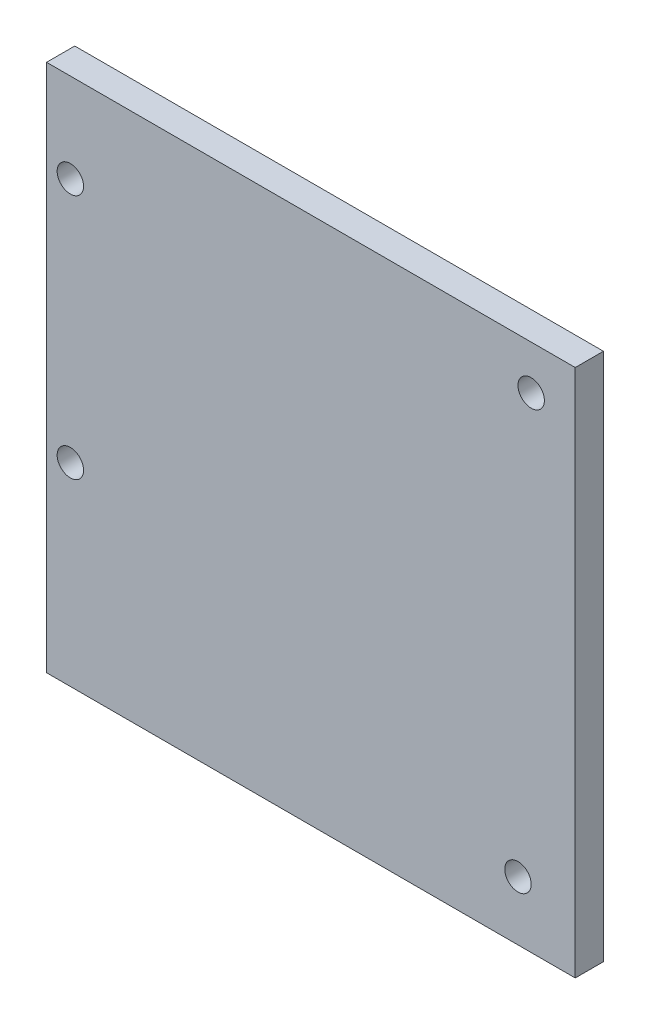
from build123d import *

# Parameters (mm, degrees)
SKETCH2_W           = 60
SKETCH2_H           = 60
BOSS_EXTRUDE2_DEPTH = 3.2
SKETCH3_R           = 1.5
CUT_EXTRUDE1_DEPTH  = 3.2


with BuildPart() as part:
    # Sketch2 → Boss-Extrude2 (new body)
    with BuildSketch(Plane.XY):
        with Locations((-2.549375328, 21.639166253)):
            Rectangle(SKETCH2_W, SKETCH2_H)
    extrude(amount=BOSS_EXTRUDE2_DEPTH)

    # Sketch3 → Cut-Extrude1 (cut)
    with BuildSketch(Plane.XY.offset(3.2)):
        with Locations((20.950624672, -1.660833747)):
            Circle(SKETCH3_R)
        with Locations((22.450624672, 46.639166253)):
            Circle(SKETCH3_R)
        with Locations((-29.849375328, 13.639166253)):
            Circle(SKETCH3_R)
        with Locations((-29.849375328, 41.539166253)):
            Circle(SKETCH3_R)
    extrude(amount=-CUT_EXTRUDE1_DEPTH, mode=Mode.SUBTRACT)


solid = part.part
